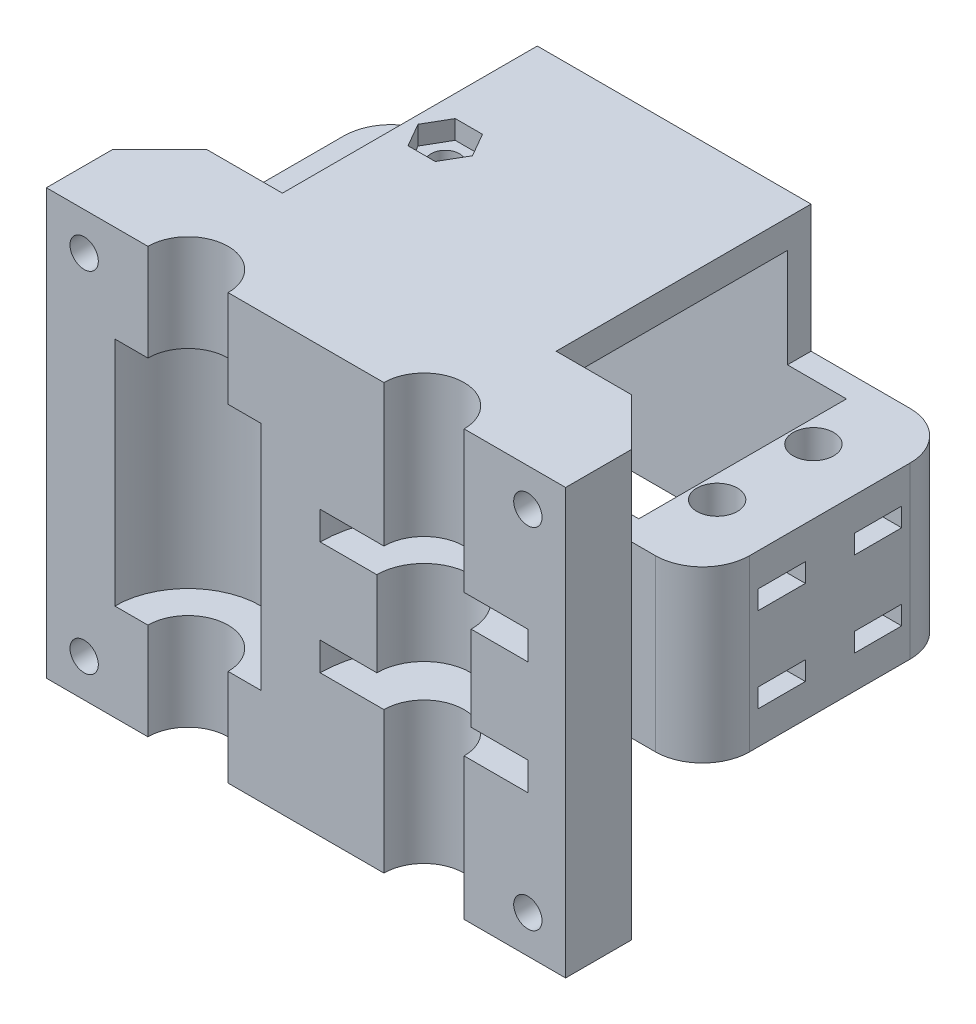
from build123d import *

# Parameters (mm, degrees)
ESQUISSE1_W                  = 55
ESQUISSE1_H                  = 45
BOSS_EXTRU_1_DEPTH           = 12
ESQUISSE2_R                  = 4.25
ENL_V_MAT_EXTRU_1_DEPTH      = 55.085580333
ENL_V_MAT_EXTRU_2_DEPTH      = 12.25
ENL_V_MAT_EXTRU_2_DEPTH_BACK = 12.25
ESQUISSE3_R                  = 7.75
ESQUISSE4_R                  = 11
ENL_V_MAT_EXTRU_3_DEPTH      = 3
ESQUISSE5_R                  = 5
ENL_V_MAT_EXTRU_4_DEPTH      = 15
ENL_V_MAT_EXTRU_5_DEPTH      = 38.503333185
ENL_V_MAT_EXTRU_5_DEPTH_BACK = 38.503333185
ESQUISSE6_R                  = 1.5
ESQUISSE7_R                  = 2.5
ENL_V_MAT_EXTRU_6_DEPTH      = 4
CHANFREIN3_SIZE              = 5
ESQUISSE9_W                  = 60
ESQUISSE9_H                  = 18
BOSS_EXTRU_2_DEPTH           = 27
ESQUISSE10_W                 = 41.5
ESQUISSE10_H                 = 22
ENL_V_MAT_EXTRU_7_DEPTH      = 30
ESQUISSE11_R                 = 2.15
ENL_V_MAT_EXTRU_8_DEPTH      = 52.198144498
CONG_2_R                     = 5
CONG_3_R                     = 5
ESQUISSE12_W                 = 5
ESQUISSE12_H                 = 2
ENL_V_MAT_EXTRU_9_DEPTH      = 9
SYM_TRIE4_COPY_1_SKETCH_W    = 5
SYM_TRIE4_COPY_1_SKETCH_H    = 2
SYM_TRIE4_COPY_1_DEPTH       = 9
ESQUISSE13_W                 = 29
ESQUISSE13_H                 = 3
BOSS_EXTRU_3_DEPTH           = 27
BOSS_EXTRU_4_REACH           = 53.198
ESQUISSE14_W                 = 29
ESQUISSE14_H                 = 2.5
ESQUISSE15_R                 = 1.5
ENL_V_MAT_EXTRU_10_DEPTH     = 9
ENL_V_MAT_EXTRU_11_DEPTH     = 2


with BuildPart() as part:
    # Esquisse1 → Boss.-Extru.1 (new body)
    with BuildSketch(Plane.XY):
        Rectangle(ESQUISSE1_W, ESQUISSE1_H)
    extrude(amount=BOSS_EXTRU_1_DEPTH)

    # Esquisse2 → Enlèv. mat.-Extru.1 (cut, through all)
    with BuildSketch(Plane(origin=(0, 22.5, 0), x_dir=(1, 0, 0), z_dir=(0, 1, 0))):
        with Locations((-12.5, -12)):
            Circle(ESQUISSE2_R)
        with Locations((12.5, -12)):
            Circle(ESQUISSE2_R)
    extrude(amount=-ENL_V_MAT_EXTRU_1_DEPTH, mode=Mode.SUBTRACT)

    # Esquisse3 → Enlèv. mat.-Extru.2 (cut, two sides: drawn at the far end of the back side and taken through both)
    with BuildSketch(Plane(origin=(0, 0, 0), x_dir=(1, 0, 0), z_dir=(0, 1, 0)).offset(-ENL_V_MAT_EXTRU_2_DEPTH_BACK)):
        with Locations((-12.5, -12)):
            Circle(ESQUISSE3_R)
    extrude(amount=ENL_V_MAT_EXTRU_2_DEPTH + ENL_V_MAT_EXTRU_2_DEPTH_BACK, mode=Mode.SUBTRACT)

    # Esquisse4 → Enlèv. mat.-Extru.3 (cut)
    with BuildSketch(Plane(origin=(0, 7.5, 0), x_dir=(1, 0, 0), z_dir=(0, 1, 0))):
        with Locations((12.5, -12)):
            Circle(ESQUISSE4_R)
    enl_v_mat_extru_3 = extrude(amount=-ENL_V_MAT_EXTRU_3_DEPTH, mode=Mode.SUBTRACT)

    # Esquisse5 → Enlèv. mat.-Extru.4 (cut)
    with BuildSketch(Plane(origin=(0, 7.5, 0), x_dir=(1, 0, 0), z_dir=(0, 1, 0))):
        with Locations((12.5, -12)):
            Circle(ESQUISSE5_R)
    extrude(amount=-ENL_V_MAT_EXTRU_4_DEPTH, mode=Mode.SUBTRACT)

    # Esquisse6 → Enlèv. mat.-Extru.5 (cut, two sides: drawn at the far end of the back side and taken through both)
    with BuildSketch(Plane(origin=(0, 0, 0), x_dir=(-1, 0, 0), z_dir=(0, 0, -1)).offset(-ENL_V_MAT_EXTRU_5_DEPTH_BACK)):
        with Locations((23.5, -18.5)):
            Circle(ESQUISSE6_R)
        with Locations((-23.5, -18.5)):
            Circle(ESQUISSE6_R)
        with Locations((-23.5, 18.5)):
            Circle(ESQUISSE6_R)
        with Locations((23.5, 18.5)):
            Circle(ESQUISSE6_R)
    extrude(amount=ENL_V_MAT_EXTRU_5_DEPTH + ENL_V_MAT_EXTRU_5_DEPTH_BACK, mode=Mode.SUBTRACT)

    # Esquisse7 → Enlèv. mat.-Extru.6 (cut)
    with BuildSketch(Plane(origin=(0, 0, 0), x_dir=(-1, 0, 0), z_dir=(0, 0, -1))):
        with Locations((23.5, -18.5)):
            Circle(ESQUISSE7_R)
        with Locations(Location((23.5, 18.5, 0), (0, 0, 180))):
            Circle(ESQUISSE7_R)
        with Locations((-23.5, 18.5)):
            Circle(ESQUISSE7_R)
        with Locations(Location((-23.5, -18.5, 0), (0, 0, 180))):
            Circle(ESQUISSE7_R)
    extrude(amount=-ENL_V_MAT_EXTRU_6_DEPTH, mode=Mode.SUBTRACT)

    # Chanfrein3
    # the kernel refuses this chamfer: 5 mm, written as the material it takes off along each edge
    with BuildSketch(Plane(origin=(-27.5, 35.35841494, 0), x_dir=(0.9996219169112968, 0, -0.027495876610586372), z_dir=(0, -1, 0)), Plane(origin=(27.5, -35.35841494, 0), x_dir=(-0.9996219169112968, 0, -0.027495876610586372), z_dir=(0, 1, 0))) as chanfrein3_piece_1:
        Polygon((CHANFREIN3_SIZE * 0.999621916911, CHANFREIN3_SIZE * 0.0274958766106), (-CHANFREIN3_SIZE * 0.0274958766106, CHANFREIN3_SIZE * 0.999621916911), (0, 0), align=None)
    extrude(amount=70.71682988, mode=Mode.SUBTRACT)

    # Symétrie2: Enlèv. mat.-Extru.3 across plane
    add(enl_v_mat_extru_3.mirror(Plane.ZX), mode=Mode.SUBTRACT)

    # Esquisse9 → Boss.-Extru.2 (add)
    with BuildSketch(Plane(origin=(0, 0, 0), x_dir=(-1, 0, 0), z_dir=(0, 0, -1))):
        Rectangle(ESQUISSE9_W, ESQUISSE9_H)
    extrude(amount=BOSS_EXTRU_2_DEPTH)

    # Esquisse10 → Enlèv. mat.-Extru.7 (cut)
    with BuildSketch(Plane(origin=(0, 9, 0), x_dir=(1, 0, 0), z_dir=(0, 1, 0))):
        with Locations((0, 13.5)):
            Rectangle(ESQUISSE10_W, ESQUISSE10_H)
    extrude(amount=-ENL_V_MAT_EXTRU_7_DEPTH, mode=Mode.SUBTRACT)

    # Esquisse11 → Enlèv. mat.-Extru.8 (cut, through all)
    with BuildSketch(Plane(origin=(0, -9, 0), x_dir=(-1, 0, 0), z_dir=(0, -1, 0))):
        with Locations(Location((-23.15, 8.4, 0), (0, 0, 90))):
            Circle(ESQUISSE11_R)
        with Locations(Location((-23.15, 18.6, 0), (0, 0, 90))):
            Circle(ESQUISSE11_R)
        with Locations(Location((24.65, 8.4, 0), (0, 0, 90))):
            Circle(ESQUISSE11_R)
        with Locations(Location((24.65, 18.6, 0), (0, 0, 90))):
            Circle(ESQUISSE11_R)
    extrude(amount=-ENL_V_MAT_EXTRU_8_DEPTH, mode=Mode.SUBTRACT)

    # Congé2
    cong_2_edges = [part.edges().sort_by_distance(p)[0] for p in [
        (-30, 0, 0),
        (30, 0, 0),
    ]]
    fillet(cong_2_edges, radius=CONG_2_R)

    # Congé3
    cong_3_edges = [part.edges().sort_by_distance(p)[0] for p in [
        (-30, 0, -27),
        (30, 0, -27),
    ]]
    fillet(cong_3_edges, radius=CONG_3_R)

    # Esquisse12 → Enlèv. mat.-Extru.9 (cut)
    with BuildSketch(Plane(origin=(30, 0, 0), x_dir=(0, 0, -1), z_dir=(1, 0, 0))):
        with Locations((8.4, 4.5)):
            Rectangle(ESQUISSE12_W, ESQUISSE12_H)
        with Locations((18.6, 4.5)):
            Rectangle(ESQUISSE12_W, ESQUISSE12_H)
    enl_v_mat_extru_9 = extrude(amount=-ENL_V_MAT_EXTRU_9_DEPTH, mode=Mode.SUBTRACT)

    # Symétrie3: Enlèv. mat.-Extru.9 across plane
    add(enl_v_mat_extru_9.mirror(Plane(origin=(0, 0, 0), x_dir=(0, 0, 1), z_dir=(1, 0, 0))), mode=Mode.SUBTRACT)

    # Symétrie4: Enlèv. mat.-Extru.9 across plane
    add(enl_v_mat_extru_9.mirror(Plane.ZX), mode=Mode.SUBTRACT)

    # Symétrie4 copy 1 sketch → Symétrie4 copy 1 (cut)
    with BuildSketch(Plane(origin=(-30, 0, 0), x_dir=(0, 0, -1), z_dir=(-1, 0, 0))):
        with Locations((8.4, 4.5)):
            Rectangle(SYM_TRIE4_COPY_1_SKETCH_W, SYM_TRIE4_COPY_1_SKETCH_H)
        with Locations((18.6, 4.5)):
            Rectangle(SYM_TRIE4_COPY_1_SKETCH_W, SYM_TRIE4_COPY_1_SKETCH_H)
    extrude(amount=-SYM_TRIE4_COPY_1_DEPTH, mode=Mode.SUBTRACT)

    # Esquisse13 → Boss.-Extru.3 (add)
    with BuildSketch(Plane(origin=(0, 0, 0), x_dir=(-1, 0, 0), z_dir=(0, 0, -1))):
        with Locations((0, 21)):
            Rectangle(ESQUISSE13_W, ESQUISSE13_H)
    extrude(amount=BOSS_EXTRU_3_DEPTH)

    # Esquisse14 → Boss.-Extru.4 (add, up to next)
    with BuildSketch(Plane(origin=(0, 9, 0), x_dir=(1, 0, 0), z_dir=(0, 1, 0)), mode=Mode.PRIVATE) as boss_extru_4_sk1:
        with Locations((0, 25.75)):
            Rectangle(ESQUISSE14_W, ESQUISSE14_H)
    boss_extru_4_tool1 = extrude(boss_extru_4_sk1.sketch, amount=BOSS_EXTRU_4_REACH, mode=Mode.PRIVATE) - part.part
    add(boss_extru_4_tool1.solids().sort_by_distance((0, 9, -25.75))[0])

    # Esquisse15 → Enlèv. mat.-Extru.10 (cut)
    with BuildSketch(Plane(origin=(0, 22.5, 0), x_dir=(1, 0, 0), z_dir=(0, 1, 0))):
        with Locations(Location((-10.75, 13.5, 0), (0, 0, 270))):
            Circle(ESQUISSE15_R)
    extrude(amount=-ENL_V_MAT_EXTRU_10_DEPTH, mode=Mode.SUBTRACT)

    # Esquisse16 → Enlèv. mat.-Extru.11 (cut)
    with BuildSketch(Plane(origin=(0, 22.5, 0), x_dir=(1, 0, 0), z_dir=(0, 1, 0))):
        Polygon((-9.306624327, 16), (-12.193375673, 16), (-13.636751346, 13.5), (-12.193375673, 11), (-9.306624327, 11), (-7.863248654, 13.5), align=None)
    extrude(amount=-ENL_V_MAT_EXTRU_11_DEPTH, mode=Mode.SUBTRACT)


solid = part.part
